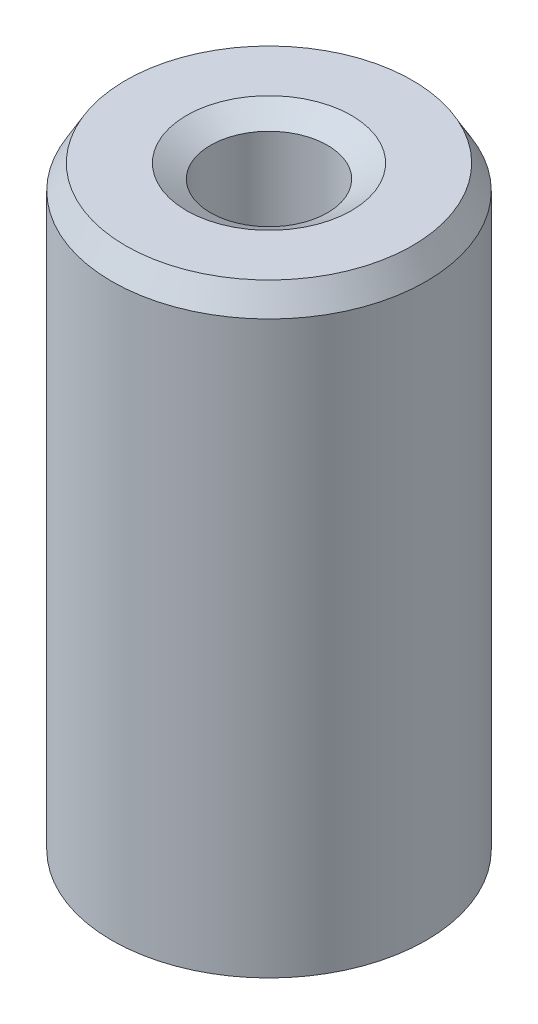
from build123d import *
from OCP.BRepFilletAPI import BRepFilletAPI_MakeChamfer

# Parameters (mm, degrees)
SKETCH1_R           = 15
BOSS_EXTRUDE1_DEPTH = 58.072822403
SKETCH2_R           = 5.582549754
CUT_EXTRUDE1_DEPTH  = 62.82598727
CHAMFER1_SIZE       = 2.288859009
CHAMFER1_SIZE2      = 1.321473365


with BuildPart() as part:
    # Sketch1 → Boss-Extrude1 (new body)
    with BuildSketch(Plane(origin=(0, 0, 0), x_dir=(1, 0, 0), z_dir=(0, 1, 0))):
        Circle(SKETCH1_R)
    extrude(amount=BOSS_EXTRUDE1_DEPTH)

    # Sketch2 → Cut-Extrude1 (cut, through all)
    with BuildSketch(Plane(origin=(0, 0, 0), x_dir=(1, 0, 0), z_dir=(0, 1, 0))):
        Circle(SKETCH2_R)
    extrude(amount=CUT_EXTRUDE1_DEPTH, mode=Mode.SUBTRACT)

    # Chamfer1: one chamfer whose edges measure the first distance from different faces: ONE call of the kernel's chamfer builder (chamfer() names one face for all edges)
    chamfer1_edges_1 = [part.edges().sort_by_distance(p)[0] for p in [
        (-5.582549754, 58.072822403, 0),
    ]]
    chamfer1_side_1 = [part.faces().sort_by_distance(p)[0] for p in [
        (-14.575735931, 58.072822403, 0),
    ]]
    chamfer1_edges_2 = [part.edges().sort_by_distance(p)[0] for p in [
        (-5.582549754, 0, 0),
    ]]
    chamfer1_side_2 = [part.faces().sort_by_distance(p)[0] for p in [
        (-5.582549754, 29.036411202, 0),
    ]]
    chamfer1_edges_3 = [part.edges().sort_by_distance(p)[0] for p in [
        (-15, 0, 0),
    ]]
    chamfer1_side_3 = [part.faces().sort_by_distance(p)[0] for p in [
        (-14.575735931, 0, 0),
    ]]
    chamfer1_edges_4 = [part.edges().sort_by_distance(p)[0] for p in [
        (-15, 58.072822403, 0),
    ]]
    chamfer1_side_4 = [part.faces().sort_by_distance(p)[0] for p in [
        (-15, 29.036411202, 0),
    ]]
    chamfer1 = BRepFilletAPI_MakeChamfer(part.part.solid().wrapped)
    for e in chamfer1_edges_1:
        chamfer1.Add(CHAMFER1_SIZE, CHAMFER1_SIZE2, e.wrapped, chamfer1_side_1[0].wrapped)  # the first distance lies on this face
    for e in chamfer1_edges_2:
        chamfer1.Add(CHAMFER1_SIZE, CHAMFER1_SIZE2, e.wrapped, chamfer1_side_2[0].wrapped)  # the first distance lies on this face
    for e in chamfer1_edges_3:
        chamfer1.Add(CHAMFER1_SIZE, CHAMFER1_SIZE2, e.wrapped, chamfer1_side_3[0].wrapped)  # the first distance lies on this face
    for e in chamfer1_edges_4:
        chamfer1.Add(CHAMFER1_SIZE, CHAMFER1_SIZE2, e.wrapped, chamfer1_side_4[0].wrapped)  # the first distance lies on this face
    add(Compound.cast(chamfer1.Shape()), mode=Mode.REPLACE)


solid = part.part
